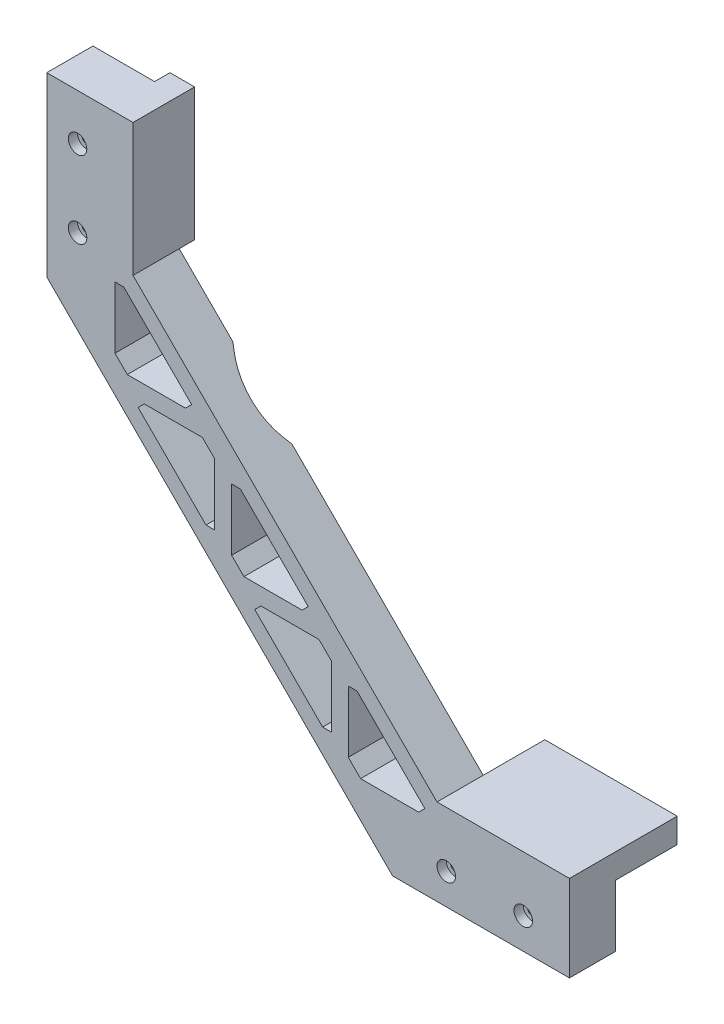
from build123d import *

# Parameters (mm, degrees)
EXTRUDE_1_DEPTH     = 15
SKETCH_3_W          = 43
SKETCH_3_H          = 8
EXTRUDE_2_DEPTH     = 35
SKETCH_4_W          = 8
SKETCH_4_H          = 43
EXTRUDE_3_DEPTH     = 35
CUT_EXTRUDE_1_DEPTH = 244.161454645
SKETCH_6_R          = 1.6
CUT_EXTRUDE_2_DEPTH = 244.161454645
SKETCH_7_R          = 3
CUT_EXTRUDE_3_DEPTH = 3
CHAMFER_1_SIZE      = 2.828427125
CHAMFER_1_SIZE_2    = 4
CUT_EXTRUDE_4_DEPTH = 133
SKETCH_10_W         = 8
SKETCH_10_H         = 15
CUT_EXTRUDE_5_DEPTH = 43


with BuildPart() as part:
    # 草图1 → 凸台-拉伸1 (new body)
    with BuildSketch(Plane.XY):
        Polygon((124.695, -160), (159.695, -160), (159.695, -180), (102.268593129, -180), (-10, -67.731406871), (-10, -10.305), (10, -10.305), (10, -45.305), align=None)
    extrude(amount=EXTRUDE_1_DEPTH)

    # 草图3 → 凸台-拉伸2 (add)
    with BuildSketch(Plane.XY.offset(15)):
        with Locations((138.195, -156)):
            Rectangle(SKETCH_3_W, SKETCH_3_H)
    extrude(amount=-EXTRUDE_2_DEPTH)

    # 草图4 → 凸台-拉伸3 (add)
    with BuildSketch(Plane.XY.offset(15)):
        with Locations((14, -31.805)):
            Rectangle(SKETCH_4_W, SKETCH_4_H)
    extrude(amount=-EXTRUDE_3_DEPTH)

    # 草图5 → 切除-拉伸1 (cut, through all)
    with BuildSketch(Plane.XY.offset(15)):
        Polygon((50.023383861, -93.106558454), (50.023383861, -119.976616139), (76.893441546, -119.976616139), align=None)
        Polygon((55.523383861, -125.476616139), (82.393441546, -125.476616139), (82.393441546, -152.346673824), align=None)
        Polygon((12.153326176, -55.236500769), (12.153326176, -82.106558454), (39.023383861, -82.106558454), align=None)
        Polygon((87.893441546, -130.976616139), (87.893441546, -157.846673824), (114.763499231, -157.846673824), align=None)
        Polygon((17.653326176, -87.606558454), (44.523383861, -87.606558454), (44.523383861, -114.476616139), align=None)
    extrude(amount=-CUT_EXTRUDE_1_DEPTH, mode=Mode.SUBTRACT)

    # 草图6 → 切除-拉伸2 (cut, through all)
    with BuildSketch(Plane.XY.offset(15)):
        with Locations((0, -50.305)):
            Circle(SKETCH_6_R)
        with Locations((0, -25.305)):
            Circle(SKETCH_6_R)
        with Locations((119.695, -170)):
            Circle(SKETCH_6_R)
        with Locations((144.695, -170)):
            Circle(SKETCH_6_R)
    extrude(amount=-CUT_EXTRUDE_2_DEPTH, mode=Mode.SUBTRACT)

    # 草图7 → 切除-拉伸3 (cut)
    with BuildSketch(Plane.XY.offset(15)):
        with Locations((0, -25.305)):
            Circle(SKETCH_7_R)
        with Locations((0, -50.305)):
            Circle(SKETCH_7_R)
        with Locations((119.695, -170)):
            Circle(SKETCH_7_R)
        with Locations((144.695, -170)):
            Circle(SKETCH_7_R)
    extrude(amount=-CUT_EXTRUDE_3_DEPTH, mode=Mode.SUBTRACT)

    # 倒角1
    # the kernel refuses this chamfer: 4, 2.828427125 mm, written as the material it adds along each edge
    with BuildSketch(Plane(origin=(82.393441546, -152.346673824, 15), x_dir=(0.05647824947248942, 0.9984038297885898, 0), z_dir=(0, 0, -1)), Plane(origin=(55.523383861, -125.476616139, 15), x_dir=(0.6660419652145875, -0.7459142715976752, 0), z_dir=(0, 0, -1)), Plane(origin=(87.893441546, -130.976616139, 15), x_dir=(-0.05647824947248942, -0.9984038297885898, 0), z_dir=(0, 0, -1)), Plane(origin=(12.153326176, -55.236500769, 15), x_dir=(-0.05647824947249038, -0.9984038297885897, 0), z_dir=(0, 0, -1)), Plane(origin=(44.523383861, -114.476616139, 15), x_dir=(0.05647824947248914, 0.9984038297885898, 0), z_dir=(0, 0, -1)), Plane(origin=(17.653326176, -87.606558454, 15), x_dir=(0.6660419652145882, -0.7459142715976745, 0), z_dir=(0, 0, -1)), Plane(origin=(50.023383861, -93.106558454, 15), x_dir=(-0.05647824947248914, -0.9984038297885898, 0), z_dir=(0, 0, -1))) as chamfer_1_piece_1:
        Polygon((CHAMFER_1_SIZE * 0.998403829699, -CHAMFER_1_SIZE * 0.0564782494674), (CHAMFER_1_SIZE_2 * 0.666041965215, -CHAMFER_1_SIZE_2 * 0.745914271598), (0, 0), align=None)
    extrude(amount=15)
    with BuildSketch(Plane(origin=(82.393441546, -125.476616139, 15), x_dir=(0.02749587661058555, -0.9996219169112968, 0), z_dir=(0, 0, -1)), Plane(origin=(87.893441546, -157.846673824, 15), x_dir=(-0.02749587661058555, 0.9996219169112968, 0), z_dir=(0, 0, -1)), Plane(origin=(12.153326176, -82.106558454, 15), x_dir=(-0.02749587661058651, 0.9996219169112968, 0), z_dir=(0, 0, -1)), Plane(origin=(44.523383861, -87.606558454, 15), x_dir=(0.027495876610585647, -0.9996219169112968, 0), z_dir=(0, 0, -1)), Plane(origin=(50.023383861, -119.976616139, 15), x_dir=(-0.027495876610585647, 0.9996219169112968, 0), z_dir=(0, 0, -1))) as chamfer_1_piece_2:
        Polygon((CHAMFER_1_SIZE_2 * 0.999621916911, CHAMFER_1_SIZE_2 * 0.0274958766106), (-CHAMFER_1_SIZE_2 * 0.0274958766106, CHAMFER_1_SIZE_2 * 0.999621916911), (0, 0), align=None)
    extrude(amount=15)
    with BuildSketch(Plane(origin=(114.763499231, -157.846673824, 15), x_dir=(-0.9996219169112968, -0.0274958766105891, 0), z_dir=(0, 0, -1)), Plane(origin=(39.023383861, -82.106558454, 15), x_dir=(-0.9996219169112968, -0.027495876610585647, 0), z_dir=(0, 0, -1)), Plane(origin=(76.893441546, -119.976616139, 15), x_dir=(-0.9996219169112968, -0.027495876610585647, 0), z_dir=(0, 0, -1))) as chamfer_1_piece_3:
        Polygon((CHAMFER_1_SIZE_2 * 0.999621916911, CHAMFER_1_SIZE_2 * 0.0274958766106), (CHAMFER_1_SIZE * 0.687396915203, CHAMFER_1_SIZE * 0.726281956812), (0, 0), align=None)
    extrude(amount=15)

    # 草图9 → 切除-拉伸4 (cut)
    with BuildSketch(Plane(origin=(0, -10.305, 0), x_dir=(1, 0, 0), z_dir=(0, 1, 0))):
        with BuildLine():
            Line((54.586563641, 0), (35.413436359, 0))
            Line((35.413436359, 0), (37.089053206, -1.18512051))
            ThreePointArc((37.089053206, -1.18512051), (45, -3.7), (52.910946794, -1.18512051))
            Line((52.910946794, -1.18512051), (54.586563641, 0))
        make_face()
    extrude(amount=-CUT_EXTRUDE_4_DEPTH, mode=Mode.SUBTRACT)

    # 草图10 → 切除-拉伸5 (cut)
    with BuildSketch(Plane(origin=(0, -10.305, 0), x_dir=(1, 0, 0), z_dir=(0, 1, 0))):
        with Locations((14, 12.5)):
            Rectangle(SKETCH_10_W, SKETCH_10_H)
    extrude(amount=-CUT_EXTRUDE_5_DEPTH, mode=Mode.SUBTRACT)


solid = part.part
